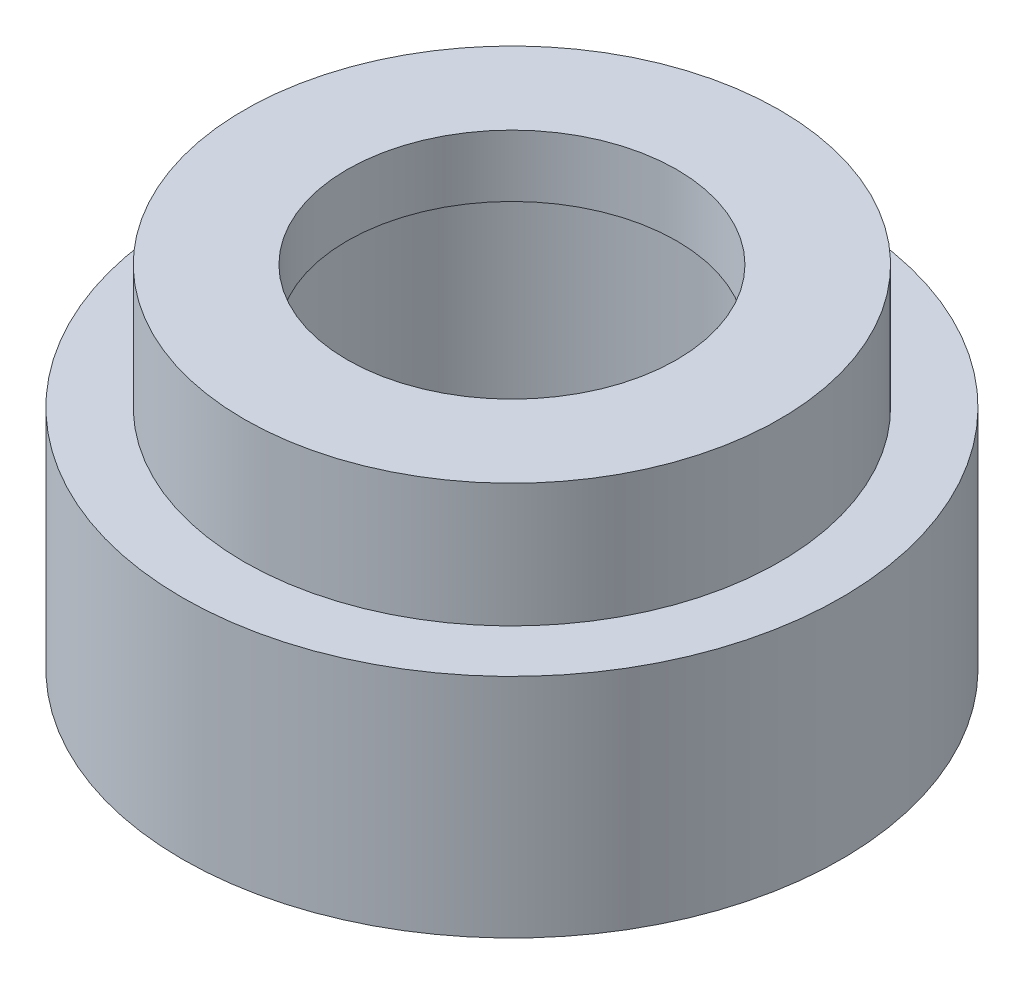
from build123d import *

# Parameters (mm, degrees)
SKETCH1_R           = 8
BOSS_EXTRUDE1_DEPTH = 5.5
SKETCH2_R           = 6.5
BOSS_EXTRUDE2_DEPTH = 3
SKETCH3_R           = 5.1
CUT_EXTRUDE1_DEPTH  = 7
SKETCH4_R           = 4
CUT_EXTRUDE2_DEPTH  = 7


with BuildPart() as part:
    # Sketch1 → Boss-Extrude1 (new body)
    with BuildSketch(Plane(origin=(0, 0, 0), x_dir=(1, 0, 0), z_dir=(0, 1, 0))):
        Circle(SKETCH1_R)
    extrude(amount=BOSS_EXTRUDE1_DEPTH)

    # Sketch2 → Boss-Extrude2 (add)
    with BuildSketch(Plane(origin=(0, 5.5, 0), x_dir=(1, 0, 0), z_dir=(0, 1, 0))):
        Circle(SKETCH2_R)
    extrude(amount=BOSS_EXTRUDE2_DEPTH)

    # Sketch3 → Cut-Extrude1 (cut)
    with BuildSketch(Plane.XZ):
        Circle(SKETCH3_R)
    extrude(amount=-CUT_EXTRUDE1_DEPTH, mode=Mode.SUBTRACT)

    # Sketch4 → Cut-Extrude2 (cut)
    with BuildSketch(Plane(origin=(0, 8.5, 0), x_dir=(1, 0, 0), z_dir=(0, 1, 0))):
        Circle(SKETCH4_R)
    extrude(amount=-CUT_EXTRUDE2_DEPTH, mode=Mode.SUBTRACT)


solid = part.part
